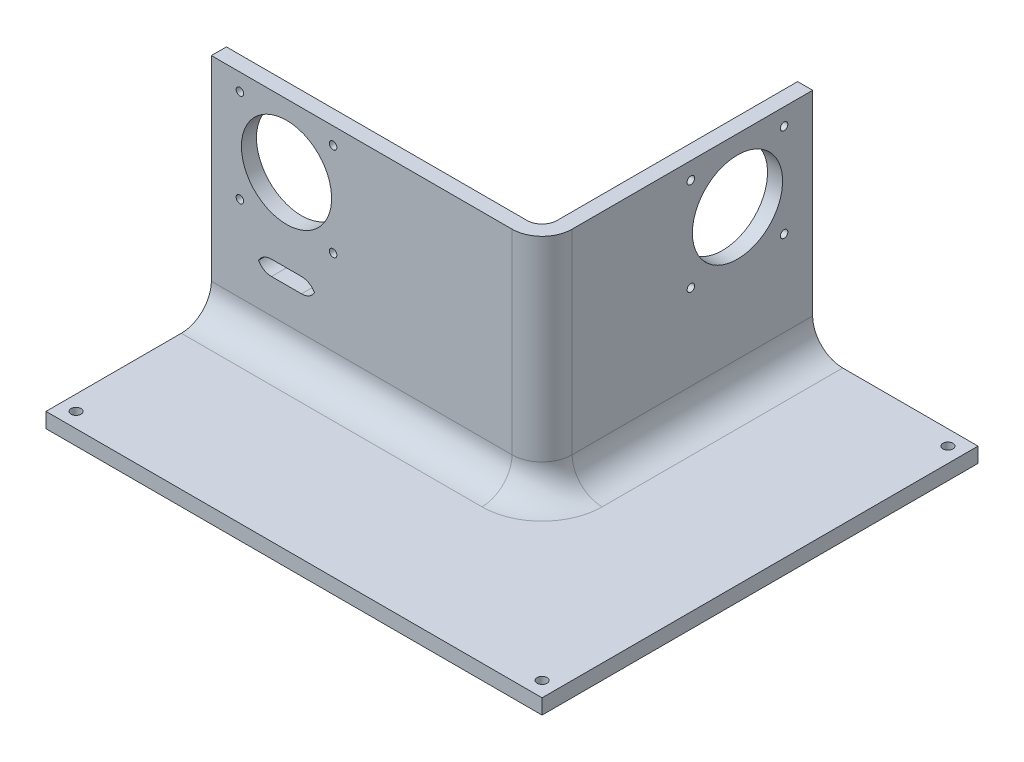
from build123d import *

# Parameters (mm, degrees)
BOSS_EXTRUDE1_DEPTH = 20
SKETCH2_W           = 5
SKETCH2_H           = 85
BOSS_EXTRUDE2_DEPTH = 60
SKETCH3_R           = 15
CUT_EXTRUDE1_DEPTH  = 100
SKETCH4_R           = 1.25
CUT_EXTRUDE2_DEPTH  = 100
SKETCH7_W           = 110
SKETCH7_H           = 5
BOSS_EXTRUDE6_DEPTH = 60
FILLET3_R           = 5
SKETCH8_W           = 25
SKETCH8_H           = 145
SKETCH8_H_2         = 25
SKETCH8_W_2         = 185
CUT_EXTRUDE3_DEPTH  = 100
SKETCH9_R           = 1.65
CUT_EXTRUDE4_DEPTH  = 100
SKETCH10_W          = 75
SKETCH10_H          = 55
SKETCH10_W_2        = 110
SKETCH10_H_2        = 90
CUT_EXTRUDE5_DEPTH  = 15
FILLET4_R           = 10
SKETCH11_W          = 20
SKETCH11_H          = 5
CUT_EXTRUDE6_DEPTH  = 6
FILLET5_R           = 5
SKETCH12_R          = 15
SKETCH12_R_2        = 1.25
CUT_EXTRUDE7_DEPTH  = 10
SKETCH13_W          = 20
SKETCH13_H          = 145
CUT_EXTRUDE8_DEPTH  = 10


with BuildPart() as part:
    # Sketch1 → Boss-Extrude1 (new body)
    with BuildSketch(Plane(origin=(0, 0, 0), x_dir=(1, 0, 0), z_dir=(0, 1, 0))):
        Polygon((105, 85), (0, 85), (0, 0), (-105, 0), (-105, -85), (105, -85), align=None)
    extrude(amount=BOSS_EXTRUDE1_DEPTH)

    # Sketch2 → Boss-Extrude2 (add)
    with BuildSketch(Plane(origin=(0, 20, 0), x_dir=(1, 0, 0), z_dir=(0, 1, 0))):
        with Locations((2.5, 42.5)):
            Rectangle(SKETCH2_W, SKETCH2_H)
    extrude(amount=BOSS_EXTRUDE2_DEPTH)

    # Sketch3 → Cut-Extrude1 (cut)
    with BuildSketch(Plane.ZY):
        with Locations((-60, 58.85)):
            Circle(SKETCH3_R)
    extrude(amount=-CUT_EXTRUDE1_DEPTH, mode=Mode.SUBTRACT)

    # Sketch4 → Cut-Extrude2 (cut)
    with BuildSketch(Plane.ZY):
        with Locations((-75.5, 74.35)):
            Circle(SKETCH4_R)
        with Locations((-44.5, 74.35)):
            Circle(SKETCH4_R)
        with Locations((-75.5, 43.35)):
            Circle(SKETCH4_R)
        with Locations((-44.5, 43.35)):
            Circle(SKETCH4_R)
    extrude(amount=-CUT_EXTRUDE2_DEPTH, mode=Mode.SUBTRACT)

    # Sketch7 → Boss-Extrude6 (add)
    with BuildSketch(Plane(origin=(0, 20, 0), x_dir=(1, 0, 0), z_dir=(0, 1, 0))):
        with Locations((-50, -2.5)):
            Rectangle(SKETCH7_W, SKETCH7_H)
    extrude(amount=BOSS_EXTRUDE6_DEPTH)

    # Fillet3
    fillet3_edges = [part.edges().sort_by_distance(p)[0] for p in [
        (0, 40, 0),
    ]]
    fillet(fillet3_edges, radius=FILLET3_R)

    # Sketch8 → Cut-Extrude3 (cut)
    with BuildSketch(Plane(origin=(0, 20, 0), x_dir=(1, 0, 0), z_dir=(0, 1, 0))):
        with Locations((92.5, 12.5)):
            Rectangle(SKETCH8_W, SKETCH8_H)
        with Locations((92.5, -72.5)):
            Rectangle(SKETCH8_W, SKETCH8_H_2)
        with Locations((-12.5, -72.5)):
            Rectangle(SKETCH8_W_2, SKETCH8_H_2)
    extrude(amount=-CUT_EXTRUDE3_DEPTH, mode=Mode.SUBTRACT)

    # Sketch9 → Cut-Extrude4 (cut)
    with BuildSketch(Plane(origin=(0, 20, 0), x_dir=(1, 0, 0), z_dir=(0, 1, 0))):
        with Locations(Location((55, 80, 0), (0, 0, 270))):
            Circle(SKETCH9_R)
        with Locations(Location((55, -55, 0), (0, 0, 270))):
            Circle(SKETCH9_R)
        with Locations(Location((-100, -55, 0), (0, 0, 270))):
            Circle(SKETCH9_R)
    extrude(amount=-CUT_EXTRUDE4_DEPTH, mode=Mode.SUBTRACT)

    # Sketch10 → Cut-Extrude5 (cut)
    with BuildSketch(Plane(origin=(0, 20, 0), x_dir=(1, 0, 0), z_dir=(0, 1, 0))):
        with Locations((42.5, -32.5)):
            Rectangle(SKETCH10_W, SKETCH10_H)
        with Locations((-50, -32.5)):
            Rectangle(SKETCH10_W_2, SKETCH10_H)
        with Locations((42.5, 40)):
            Rectangle(SKETCH10_W, SKETCH10_H_2)
    extrude(amount=-CUT_EXTRUDE5_DEPTH, mode=Mode.SUBTRACT)

    # Fillet4
    fillet4_edges = [part.edges().sort_by_distance(p)[0] for p in [
        (5, 5, -40),
        (-50, 5, 5),
        (5, 42.5, 5),
    ]]
    fillet(fillet4_edges, radius=FILLET4_R)

    # Sketch11 → Cut-Extrude6 (cut)
    with BuildSketch(Plane.XY.offset(5)):
        with Locations((-80, 28.85)):
            Rectangle(SKETCH11_W, SKETCH11_H)
    extrude(amount=-CUT_EXTRUDE6_DEPTH, mode=Mode.SUBTRACT)

    # Fillet5
    # the kernel refuses this fillet: 5 mm, written as the material it adds along each edge
    with BuildSketch(Plane(origin=(-90, 26.35, 5), x_dir=(0, 1, 0), z_dir=(0, 0, -1))) as fillet5_piece_1:
        with BuildLine():
            CenterArc((FILLET5_R, FILLET5_R), FILLET5_R, 180, 90)
            Line((0, FILLET5_R), (0, 0))
            Line((0, 0), (FILLET5_R, 0))
        make_face()
    extrude(amount=5)
    with BuildSketch(Plane(origin=(-90, 31.35, 5), x_dir=(0, -1, 0), z_dir=(0, 0, -1)), Plane(origin=(-70, 31.35, 5), x_dir=(-1, 0, 0), z_dir=(0, 0, -1)), Plane(origin=(-70, 26.35, 5), x_dir=(0, 1, 0), z_dir=(0, 0, -1))) as fillet5_piece_2:
        with BuildLine():
            CenterArc((FILLET5_R, -FILLET5_R), FILLET5_R, 90, 90)
            Line((0, -FILLET5_R), (0, 0))
            Line((0, 0), (FILLET5_R, 0))
        make_face()
    extrude(amount=5)

    # Sketch12 → Cut-Extrude7 (cut)
    with BuildSketch(Plane(origin=(0, 0, 0), x_dir=(-1, 0, 0), z_dir=(0, 0, -1))):
        with Locations((80, 58.85)):
            Circle(SKETCH12_R)
        with Locations((95.5, 74.35)):
            Circle(SKETCH12_R_2)
        with Locations((64.5, 74.35)):
            Circle(SKETCH12_R_2)
        with Locations((64.5, 43.35)):
            Circle(SKETCH12_R_2)
        with Locations((95.5, 43.35)):
            Circle(SKETCH12_R_2)
    extrude(amount=-CUT_EXTRUDE7_DEPTH, mode=Mode.SUBTRACT)

    # Sketch13 → Cut-Extrude8 (cut)
    with BuildSketch(Plane(origin=(0, 5, 0), x_dir=(1, 0, 0), z_dir=(0, 1, 0))):
        with Locations((70, 12.5)):
            Rectangle(SKETCH13_W, SKETCH13_H)
    extrude(amount=-CUT_EXTRUDE8_DEPTH, mode=Mode.SUBTRACT)


solid = part.part
